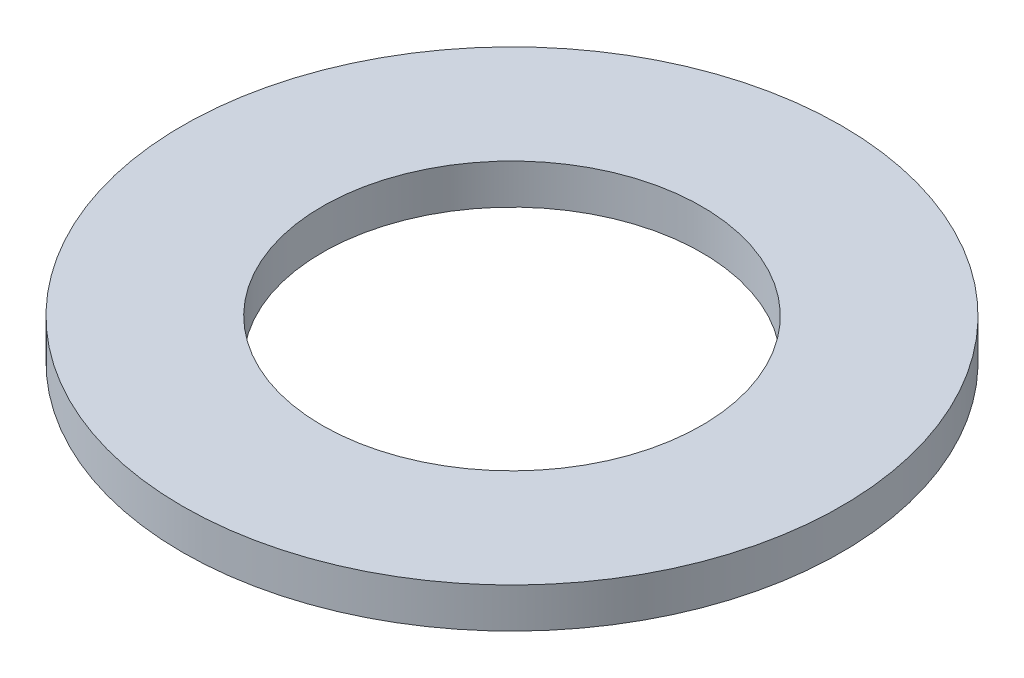
from build123d import *

# Parameters (mm, degrees)
SKETCH1_R           = 82.5
BOSS_EXTRUDE1_DEPTH = 10
SKETCH2_R           = 47.5
CUT_EXTRUDE1_DEPTH  = 118.100384286


with BuildPart() as part:
    # Sketch1 → Boss-Extrude1 (new body)
    with BuildSketch(Plane(origin=(0, 0, 0), x_dir=(1, 0, 0), z_dir=(0, 1, 0))):
        Circle(SKETCH1_R)
    extrude(amount=BOSS_EXTRUDE1_DEPTH)

    # Sketch2 → Cut-Extrude1 (cut, through all)
    with BuildSketch(Plane(origin=(0, 0, 0), x_dir=(1, 0, 0), z_dir=(0, 1, 0))):
        Circle(SKETCH2_R)
    extrude(amount=CUT_EXTRUDE1_DEPTH, mode=Mode.SUBTRACT)


solid = part.part
